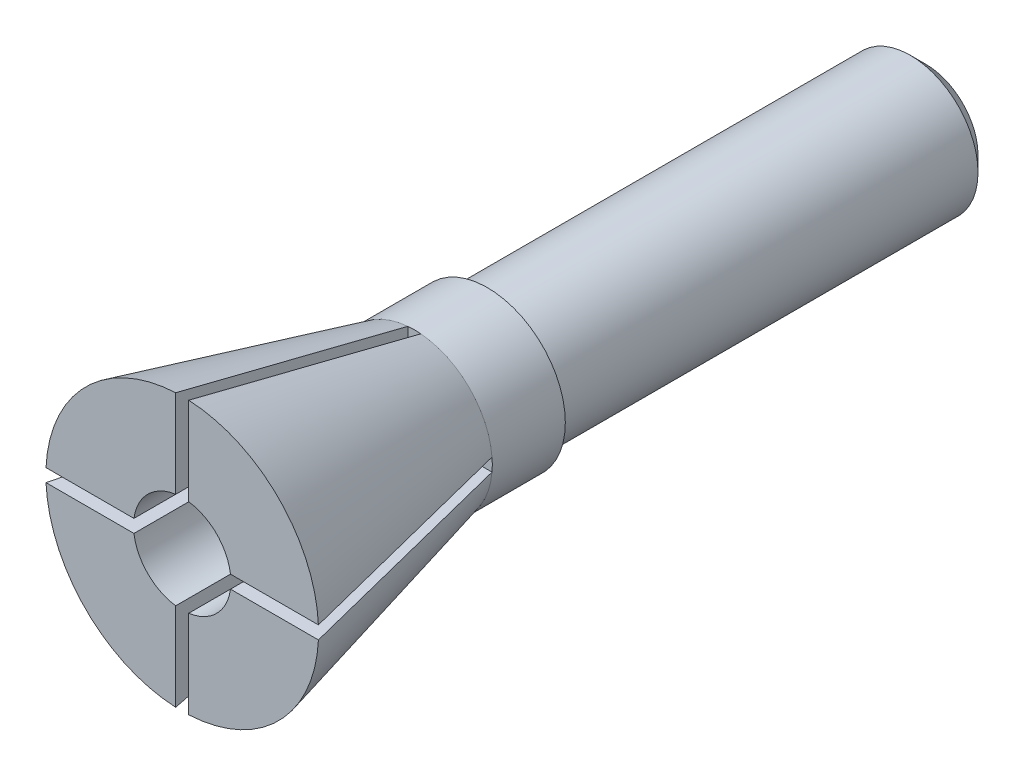
from build123d import *

# Parameters (mm, degrees)
CROQUIS1_W                 = 2.4
CROQUIS1_H                 = 22.9
CROQUIS3_R                 = 1.5
CORTAR_EXTRUIR1_DEPTH      = 9
CORTAR_EXTRUIR2_DEPTH      = 12.7
CORTAR_EXTRUIR2_DEPTH_BACK = 14
CROQUIS5_W                 = 0.4
CROQUIS5_H                 = 7.15
CORTAR_EXTRUIR3_DEPTH      = 9.7
CORTAR_EXTRUIR3_DEPTH_BACK = 14
CROQUIS6_W                 = 7.15
CROQUIS6_H                 = 0.4


# Read off the part's stored shape, not the designer's step: #8-32 Roscas Standard Taladro2
with BuildPart() as part:
    # Croquis1 → Revolución1 (revolve)
    with BuildSketch(Plane(origin=(0, 0, 0), x_dir=(1, 0, 0), z_dir=(0, 1, 0))):
        with Locations((1.2, 11.45)):
            Rectangle(CROQUIS1_W, CROQUIS1_H)
    revolve(axis=Axis((0, 0, 0), (0, 0, -1)))

    # Croquis2 → Revolución2 (revolve)
    with BuildSketch(Plane(origin=(0, 0, 0), x_dir=(1, 0, 0), z_dir=(0, 1, 0)), mode=Mode.PRIVATE) as revoluci_n2_sk:
        Polygon((-4.2, 0), (-2.4, 0), (-2.4, 7.15), align=None)
    revolve(revoluci_n2_sk.sketch.rotate(Axis((0, 0, 0), (0, 0, -1)), 180), axis=Axis((0, 0, 0), (0, 0, -1)))

    # Croquis3 → Cortar-Extruir1 (cut)
    with BuildSketch(Plane.XY):
        Circle(CROQUIS3_R)
    extrude(amount=-CORTAR_EXTRUIR1_DEPTH, mode=Mode.SUBTRACT)

    # Croquis5 → Cortar-Extruir2 (cut, two sides: drawn at the far end of the back side and taken through both)
    with BuildSketch(Plane(origin=(0, 0, 0), x_dir=(1, 0, 0), z_dir=(0, 1, 0)).offset(-CORTAR_EXTRUIR2_DEPTH_BACK)):
        with Locations((0, 3.575)):
            Rectangle(CROQUIS5_W, CROQUIS5_H)
    extrude(amount=CORTAR_EXTRUIR2_DEPTH + CORTAR_EXTRUIR2_DEPTH_BACK, mode=Mode.SUBTRACT)

    # Croquis6 → Cortar-Extruir3 (cut, two sides: drawn at the far end of the back side and taken through both)
    with BuildSketch(Plane(origin=(0, 0, 0), x_dir=(0, 0, -1), z_dir=(1, 0, 0)).offset(-CORTAR_EXTRUIR3_DEPTH_BACK)):
        with Locations((3.575, 0)):
            Rectangle(CROQUIS6_W, CROQUIS6_H)
    extrude(amount=CORTAR_EXTRUIR3_DEPTH + CORTAR_EXTRUIR3_DEPTH_BACK, mode=Mode.SUBTRACT)

    # #8-32 Roscas Standard Taladro2 outline → #8-32 Roscas Standard Taladro2 (revolve, cut)
    with BuildSketch(Plane.XZ):
        Polygon((1.61036, -22.9), (2.4, -22.9), (2.4, -9.4), (2.0828, -9.4), (2.0828, -22.42756), align=None)
    revolve(axis=Axis((0, 0, 0), (0, 0, 1)), mode=Mode.SUBTRACT)


solid = part.part
